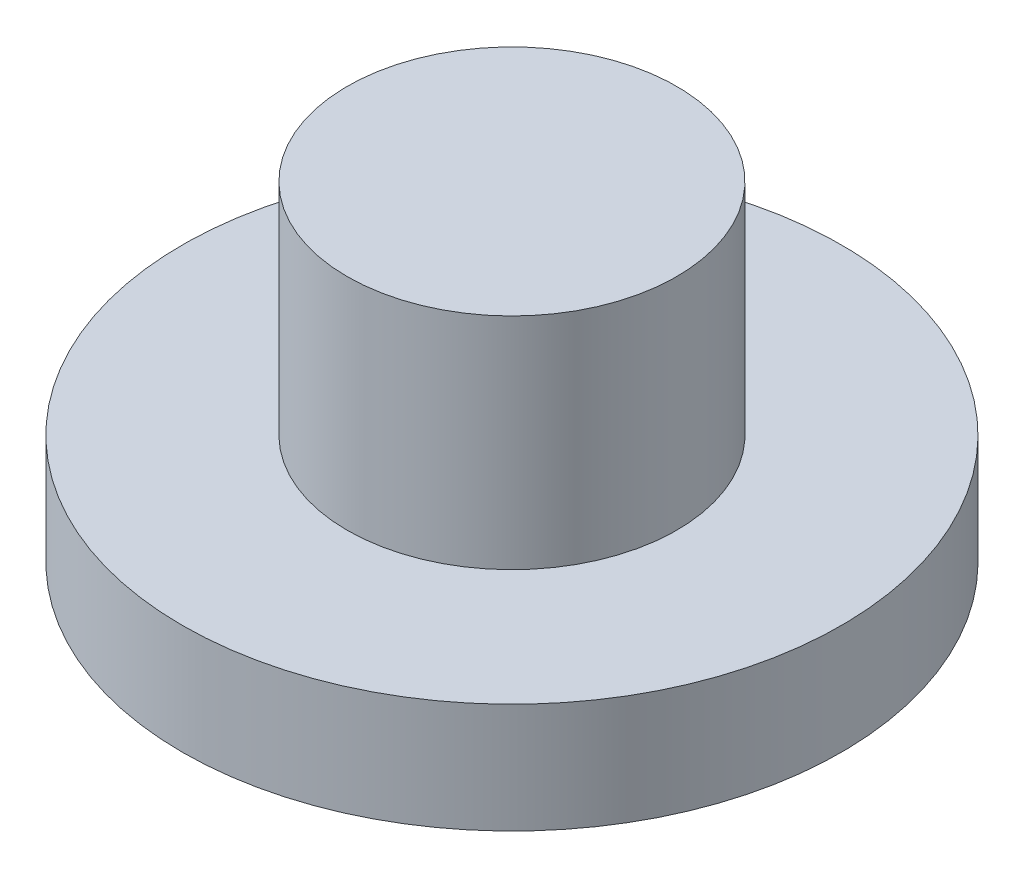
from build123d import *

# Parameters (mm, degrees)
SKETCH_1_R      = 30
EXTRUDE_1_DEPTH = 10
SKETCH_2_R      = 15
EXTRUDE_2_DEPTH = 20


with BuildPart() as part:
    # Эскиз1 → Бобышка-Вытянуть1 (new body)
    with BuildSketch(Plane(origin=(0, 0, 0), x_dir=(1, 0, 0), z_dir=(0, 1, 0))):
        Circle(SKETCH_1_R)
    extrude(amount=EXTRUDE_1_DEPTH)

    # Эскиз2 → Бобышка-Вытянуть2 (add)
    with BuildSketch(Plane(origin=(0, 10, 0), x_dir=(1, 0, 0), z_dir=(0, 1, 0))):
        Circle(SKETCH_2_R)
    extrude(amount=EXTRUDE_2_DEPTH)


solid = part.part
